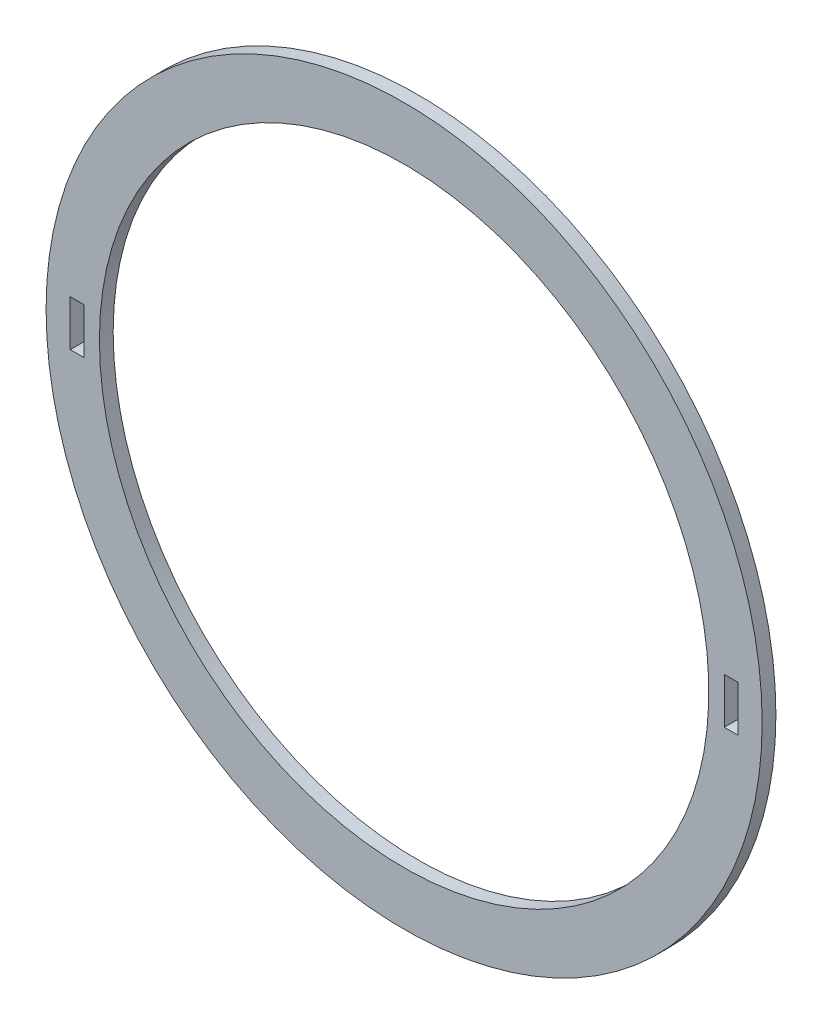
from build123d import *

# Parameters (mm, degrees)
SKETCH1_R           = 39.6875
SKETCH1_R_2         = 33.776867373
SKETCH1_W           = 1.524
SKETCH1_H           = 5.08
BOSS_EXTRUDE1_DEPTH = 1.524


with BuildPart() as part:
    # Sketch1 → Boss-Extrude1 (new body)
    with BuildSketch(Plane.XY):
        with Locations((0, 25.14119341)):
            Circle(SKETCH1_R)
        with Locations((0, 25.14119341)):
            Circle(SKETCH1_R_2, mode=Mode.SUBTRACT)
        with Locations((36.247543911, 25.14119341)):
            Rectangle(SKETCH1_W, SKETCH1_H, mode=Mode.SUBTRACT)
        with Locations((-36.247543911, 25.14119341)):
            Rectangle(SKETCH1_W, SKETCH1_H, mode=Mode.SUBTRACT)
    extrude(amount=BOSS_EXTRUDE1_DEPTH)


solid = part.part
